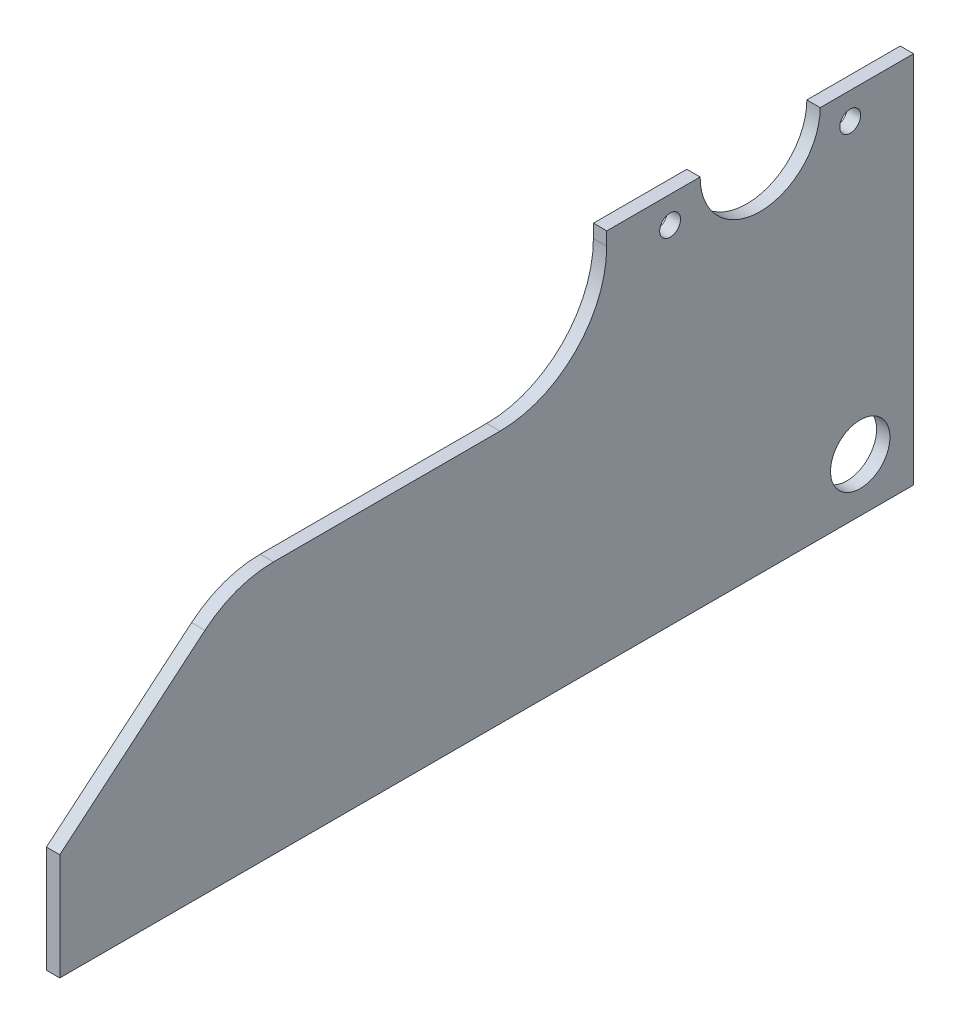
from build123d import *

# Parameters (mm, degrees)
BOSS_EXTRUDE1_DEPTH    = 3.175
F_10_CLEARANCE_HOLE1_D = 4.9784
SKETCH9_R              = 7.0739
CUT_EXTRUDE1_DEPTH     = 209.029140086


with BuildPart() as part:
    # Sketch1 → Boss-Extrude1 (new body)
    with BuildSketch(Plane(origin=(0, 0, 0), x_dir=(0, 0, -1), z_dir=(1, 0, 0))):
        with BuildLine():
            Line((0, -44.45), (0, 44.45))
            Line((0, 44.45), (-22.225, 44.45))
            ThreePointArc((-22.225, 44.45), (-36.5125, 30.1625), (-50.8, 44.45))
            Line((-50.8, 44.45), (-73.025, 44.45))
            Line((-73.025, 44.45), (-73.025, 41.275))
            ThreePointArc((-73.025, 41.275), (-80.464487758, 23.314487758), (-98.425, 15.875))
            Line((-98.425, 15.875), (-152.333161828, 15.875))
            ThreePointArc((-152.333161828, 15.875), (-161.020473469, 14.343192568), (-168.659967114, 9.932528855))
            Line((-168.659967114, 9.932528855), (-203.2, -19.05))
            Line((-203.2, -19.05), (-203.2, -44.45))
            Line((-203.2, -44.45), (0, -44.45))
        make_face()
    extrude(amount=BOSS_EXTRUDE1_DEPTH)

    # #10 Clearance Hole1 (through all)
    with Locations(Plane(origin=(3.175, 0, 0), x_dir=(0, 0, -1), z_dir=(1, 0, 0))):
        with Locations((-57.94375, 38.1), (-15.08125, 38.1)):
            Hole(F_10_CLEARANCE_HOLE1_D / 2)

    # Sketch9 → Cut-Extrude1 (cut, through all)
    with BuildSketch(Plane(origin=(3.175, 0, 0), x_dir=(0, 0, -1), z_dir=(1, 0, 0))):
        with Locations((-12.7, -31.75)):
            Circle(SKETCH9_R)
    extrude(amount=-CUT_EXTRUDE1_DEPTH, mode=Mode.SUBTRACT)


solid = part.part
